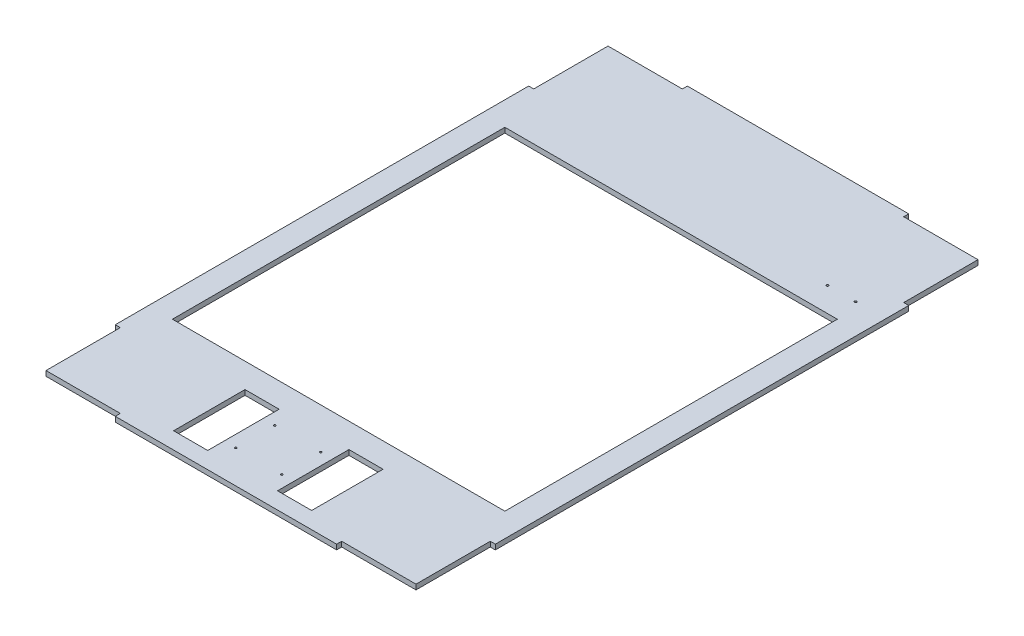
from build123d import *

# Parameters (mm, degrees)
SKETCH1_W           = 479
SKETCH1_H           = 721
SKETCH1_R           = 1.25
SKETCH1_W_2         = 419
SKETCH1_H_2         = 419
SKETCH1_W_3         = 43
SKETCH1_H_3         = 90
BOSS_EXTRUDE1_DEPTH = 3.175
CUT_EXTRUDE1_DEPTH  = 441.375774197
SKETCH3_R           = 1.375
CUT_EXTRUDE2_DEPTH  = 441.375774197


with BuildPart() as part:
    # Sketch1 → Boss-Extrude1 (new, symmetric)
    with BuildSketch(Plane(origin=(0, 0, 0), x_dir=(1, 0, 0), z_dir=(0, 1, 0))):
        with Locations((0, 9)):
            Rectangle(SKETCH1_W, SKETCH1_H)
        with Locations((-29, -310)):
            Circle(SKETCH1_R, mode=Mode.SUBTRACT)
        with Locations((-29, -261)):
            Circle(SKETCH1_R, mode=Mode.SUBTRACT)
        with Locations((29, -261)):
            Circle(SKETCH1_R, mode=Mode.SUBTRACT)
        with Locations((29, -310)):
            Circle(SKETCH1_R, mode=Mode.SUBTRACT)
        Rectangle(SKETCH1_W_2, SKETCH1_H_2, mode=Mode.SUBTRACT)
        with Locations((-65.5, -285.5)):
            Rectangle(SKETCH1_W_3, SKETCH1_H_3, mode=Mode.SUBTRACT)
        with Locations((65.5, -285.5)):
            Rectangle(SKETCH1_W_3, SKETCH1_H_3, mode=Mode.SUBTRACT)
    extrude(amount=BOSS_EXTRUDE1_DEPTH, both=True)

    # Sketch2 → Cut-Extrude1 (cut, through all)
    with BuildSketch(Plane(origin=(0, 3.175, 0), x_dir=(1, 0, 0), z_dir=(0, 1, 0))):
        Polygon((-239.5, 369.5), (-239.5, 269.5), (-233.15, 269.5), (-233.15, 363.15), (-139.5, 363.15), (-139.5, 369.5), align=None)
        Polygon((239.5, 369.5), (139.5, 369.5), (139.5, 363.15), (233.15, 363.15), (233.15, 269.5), (239.5, 269.5), align=None)
        Polygon((239.5, -351.5), (239.5, -251.5), (233.15, -251.5), (233.15, -345.15), (139.5, -345.15), (139.5, -351.5), align=None)
        Polygon((-239.5, -351.5), (-139.5, -351.5), (-139.5, -345.15), (-233.15, -345.15), (-233.15, -251.5), (-239.5, -251.5), align=None)
    extrude(amount=-CUT_EXTRUDE1_DEPTH, mode=Mode.SUBTRACT)

    # Sketch3 → Cut-Extrude2 (cut, through all)
    with BuildSketch(Plane(origin=(0, 3.175, 0), x_dir=(1, 0, 0), z_dir=(0, 1, 0))):
        with Locations((166.32, 240.12)):
            Circle(SKETCH3_R)
        with Locations((201.88, 240.12)):
            Circle(SKETCH3_R)
    extrude(amount=-CUT_EXTRUDE2_DEPTH, mode=Mode.SUBTRACT)


solid = part.part
